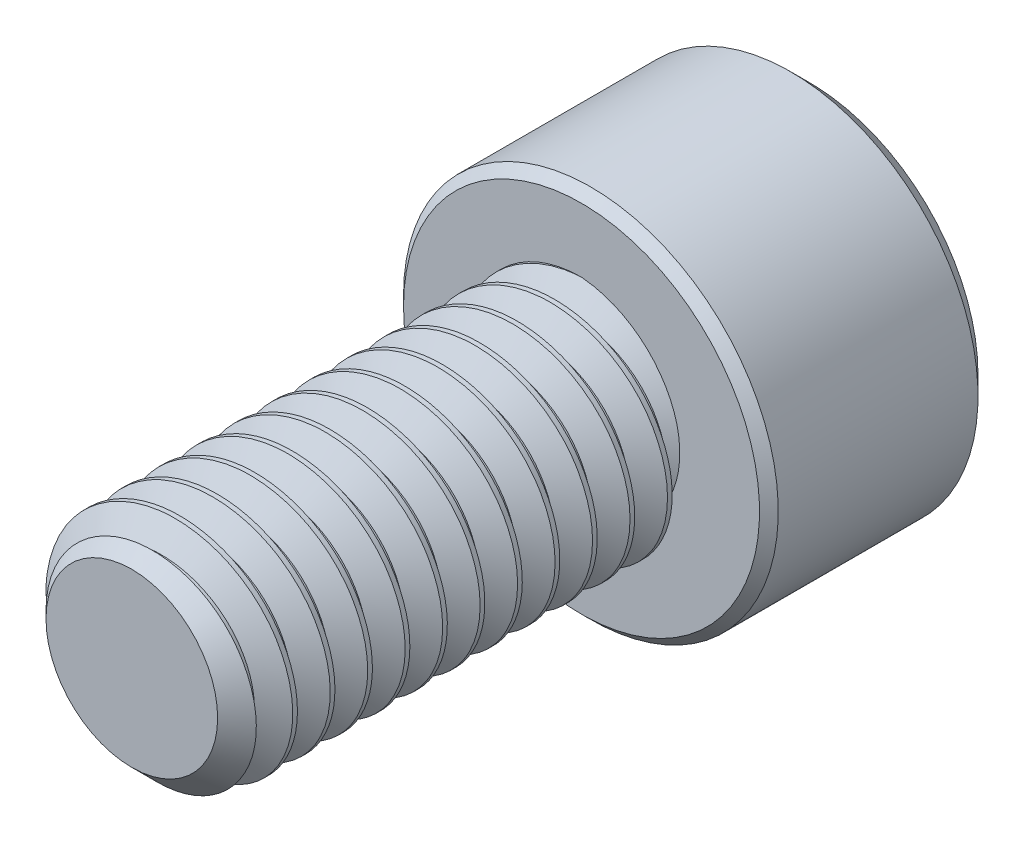
from build123d import *

# Parameters (mm, degrees)
SKETCH1_R          = 2.413
EXTRUDE1_DEPTH     = 9.525
CHAMFER3_SIZE      = 0.5953125
CUT_SWEEP1_PITCH   = 0.79375
SKETCH6_R          = 3.96875
EXTRUDE2_DEPTH     = 4.826
CUT_EXTRUDE1_DEPTH = 2.9765625
CHAMFER1_SIZE      = 0.396875
CHAMFER2_SIZE      = 0.1984375


with BuildPart() as part:
    # Sketch1 → Extrude1 (new body)
    with BuildSketch(Plane.XY):
        Circle(SKETCH1_R)
    extrude(amount=-EXTRUDE1_DEPTH)

    # Chamfer3
    chamfer3_edges = [part.edges().sort_by_distance(p)[0] for p in [
        (-2.413, 0, 0),
    ]]
    chamfer(chamfer3_edges, length=CHAMFER3_SIZE)

    # Cut-Sweep1: the profile of Sketch3 profile screwed along a right-hand helix of 13 turns, 6 arcs to a turn; built about Z, then put on its axis
    cut_sweep1_z = Axis((0, 0, 0), (0, 0, 1))
    cut_sweep1_corners = [(2.4133, 0, -0.694704455), (1.897444252, 0, -0.396875), (1.897444252, 0, -0.29765625), (2.4133, 0, 0.000173205)]
    with BuildLine(mode=Mode.PRIVATE) as cut_sweep1_profile:
        Line(cut_sweep1_corners[0], cut_sweep1_corners[1])
        Line(cut_sweep1_corners[1], cut_sweep1_corners[2])
        Line(cut_sweep1_corners[2], cut_sweep1_corners[3])
        Line(cut_sweep1_corners[3], cut_sweep1_corners[0])
    cut_sweep1_cap = Face(cut_sweep1_profile.wire())
    cut_sweep1_turn_angles = [0, 30, 60, 90, 120, 150, 180, 210, 240, 270, 300, 330, 360]
    cut_sweep1_turn_weights = [1, 0.8660254037844387, 1, 0.8660254037844387, 1, 0.8660254037844387, 1, 0.8660254037844387, 1, 0.8660254037844387, 1, 0.8660254037844387, 1]
    cut_sweep1_turn_rails = [Edge.make_bspline([Vector(p[0], p[1], 0).rotate(cut_sweep1_z, cut_sweep1_turn_angles[k]) / cut_sweep1_turn_weights[k] + Vector(0, 0, p[2] + CUT_SWEEP1_PITCH * cut_sweep1_turn_angles[k] / 360) for k in range(13)], [0, 0, 0, 1, 1, 2, 2, 3, 3, 4, 4, 5, 5, 6, 6, 6], 2, cut_sweep1_turn_weights) for p in cut_sweep1_corners]
    cut_sweep1_turn_sides = [Face.make_surface_from_curves(cut_sweep1_turn_rails[p[0]], cut_sweep1_turn_rails[p[1]]) for p in [(0, 1), (1, 2), (2, 3), (3, 0)]]
    cut_sweep1 = Plane(origin=(0, 0, 0), x_dir=(0, 1, 0), z_dir=(0, 0, -1)) * Solid(Shell([*[p.moved(Location((0, 0, CUT_SWEEP1_PITCH * i))) for i in range(13) for p in cut_sweep1_turn_sides], cut_sweep1_cap, cut_sweep1_cap.rotate(cut_sweep1_z, 4680).moved(Location((0, 0, CUT_SWEEP1_PITCH * 4680 / 360)))]))
    add(cut_sweep1, mode=Mode.SUBTRACT)

    # Sketch6 → Extrude2 (add)
    with BuildSketch(Plane(origin=(0, 0, -9.525), x_dir=(-1, 0, 0), z_dir=(0, 0, -1))):
        Circle(SKETCH6_R)
    extrude(amount=EXTRUDE2_DEPTH)

    # Sketch7 → Cut-Extrude1 (cut)
    with BuildSketch(Plane(origin=(0, 0, -14.351), x_dir=(-1, 0, 0), z_dir=(0, 0, -1))):
        Polygon((0, 2.291358881), (-1.984375, 1.14567944), (-1.984375, -1.14567944), (0, -2.291358881), (1.984375, -1.14567944), (1.984375, 1.14567944), align=None)
    extrude(amount=-CUT_EXTRUDE1_DEPTH, mode=Mode.SUBTRACT)

    # Cut-Extrude2 cone 1 section (through the dimple's axis) → Cut-Extrude2 (revolve, cut)
    with BuildSketch(Plane(origin=(0, 0, -14.351), x_dir=(0, 1, 0), z_dir=(1, 0, 0))):
        Polygon((0, 0), (2.291358881, 0), (0, 2.291358881), align=None)
    revolve(axis=Axis((0, 0, -14.351), (0, 0, 1)), mode=Mode.SUBTRACT)

    # Chamfer1
    chamfer1_edges = [part.edges().sort_by_distance(p)[0] for p in [
        (3.96875, 0, -14.351),
    ]]
    chamfer(chamfer1_edges, length=CHAMFER1_SIZE)

    # Chamfer2
    chamfer2_edges = [part.edges().sort_by_distance(p)[0] for p in [
        (3.96875, 0, -9.525),
    ]]
    chamfer(chamfer2_edges, length=CHAMFER2_SIZE)


solid = part.part
